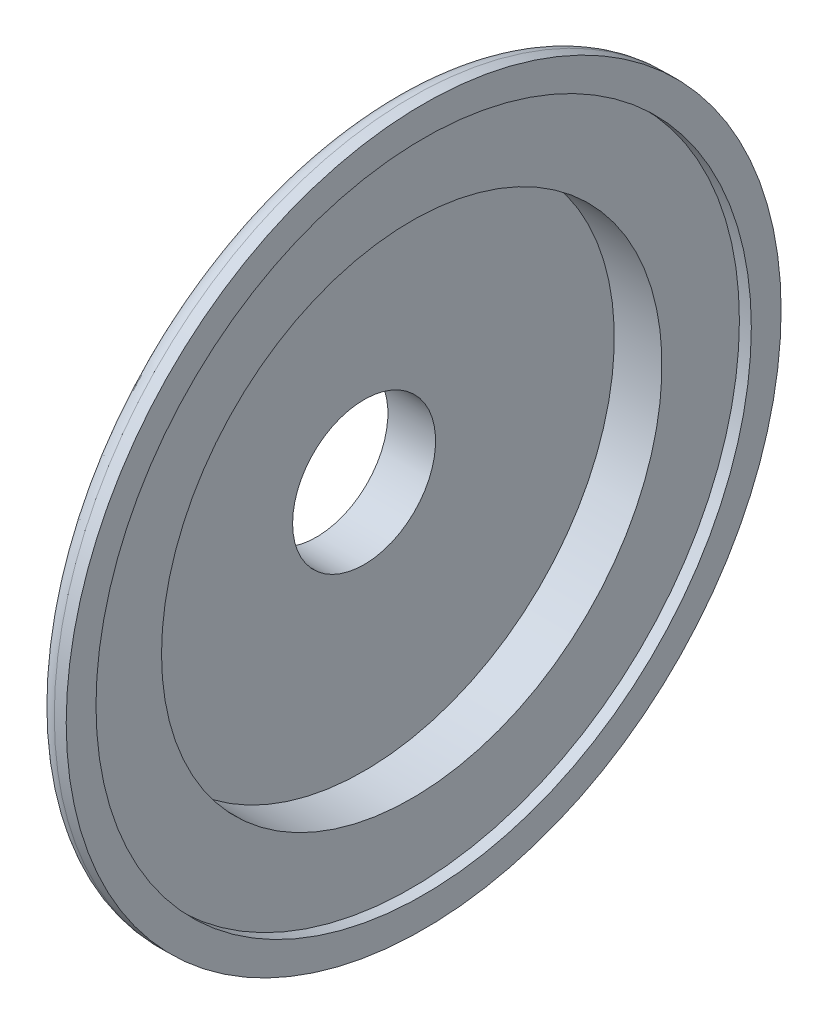
from build123d import *

# Parameters (mm, degrees)
FILLET2_R = 3


with BuildPart() as part:
    # Sketch1 → Revolve1 (revolve)
    with BuildSketch(Plane.XY, mode=Mode.PRIVATE) as revolve1_sk:
        Polygon((9, 60), (4, 60), (4, 45), (-4, 45), (-4, 15), (-9, 15), (-9, 12), (-1, 12), (-1, 42), (7, 42), (7, 55), (9, 55), align=None)
    revolve(revolve1_sk.sketch.rotate(Axis((-9, 0, 0), (1, 0, 0)), 90), axis=Axis((-9, 0, 0), (1, 0, 0)))

    # Fillet2
    fillet2_edges = [part.edges().sort_by_distance(p)[0] for p in [
        (-9, 0, -15),
        (-4, 0, -45),
        (4, 0, -60),
    ]]
    fillet(fillet2_edges, radius=FILLET2_R - 0.0001)  # a hair under: the kernel refuses the full size


solid = part.part
